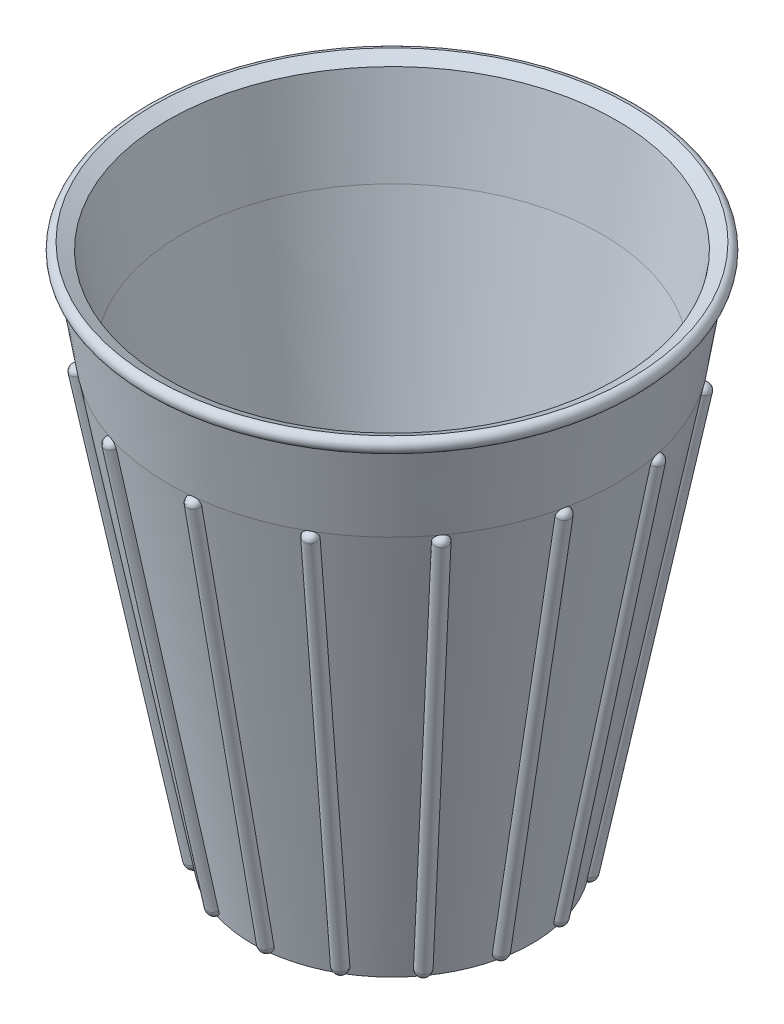
from build123d import *

# Parameters (mm, degrees)
CIRPATTERN1_COUNT = 15


with BuildPart() as part:
    # Sketch1 → Revolve1 (revolve)
    with BuildSketch(Plane.XY):
        with BuildLine():
            Line((-32.130708731, -1), (-34, 0))
            ThreePointArc((-34, 0), (-35, -1), (-34, -2))
            Line((-34, -2), (-32, -14))
            Line((-32, -14), (-20, -77))
            Line((-20, -77), (-12.6, -77))
            Line((-12.6, -77), (-12.322608601, -76.778086881))
            ThreePointArc((-12.322608601, -76.778086881), (-12.290715274, -76.666899306), (-12.385078106, -76.6))
            Line((-12.385078106, -76.6), (-12.6, -76.6))
            Line((-12.6, -76.6), (-12.6, -75.2))
            Line((-12.6, -75.2), (0, -75.2))
            Line((0, -75.2), (0, -74))
            Line((0, -74), (-18.535470636, -74))
            Line((-18.535470636, -74), (-29.964042064, -14))
            Line((-29.964042064, -14), (-32.130708731, -1))
        make_face()
    revolve(axis=Axis((0, 0, 0), (0, -1, 0)))

    # Sketch2 → Revolve7 (revolve)
    with BuildSketch(Plane.XY):
        with BuildLine():
            Line((-32, -14), (-20, -77))
            ThreePointArc((-20, -77), (-20.784277354, -76.717582079), (-21.208455158, -76))
            Line((-21.208455158, -76), (-32.827502777, -15))
            ThreePointArc((-32.827502777, -15), (-32.648991688, -14.305337999), (-32, -14))
        make_face()
    revolve7 = revolve(axis=Axis((-32.971330552, -8.900514604, 0), (0.18711210788999555, -0.9823385664224746, 0)))

    # CirPattern1: Revolve7 ×15 about axis
    cirpattern1_axis = Axis((0, -14, 0), (0, 1, 0))
    for i in range(1, CIRPATTERN1_COUNT):
        add(revolve7.rotate(cirpattern1_axis, i * 360 / CIRPATTERN1_COUNT))


solid = part.part
